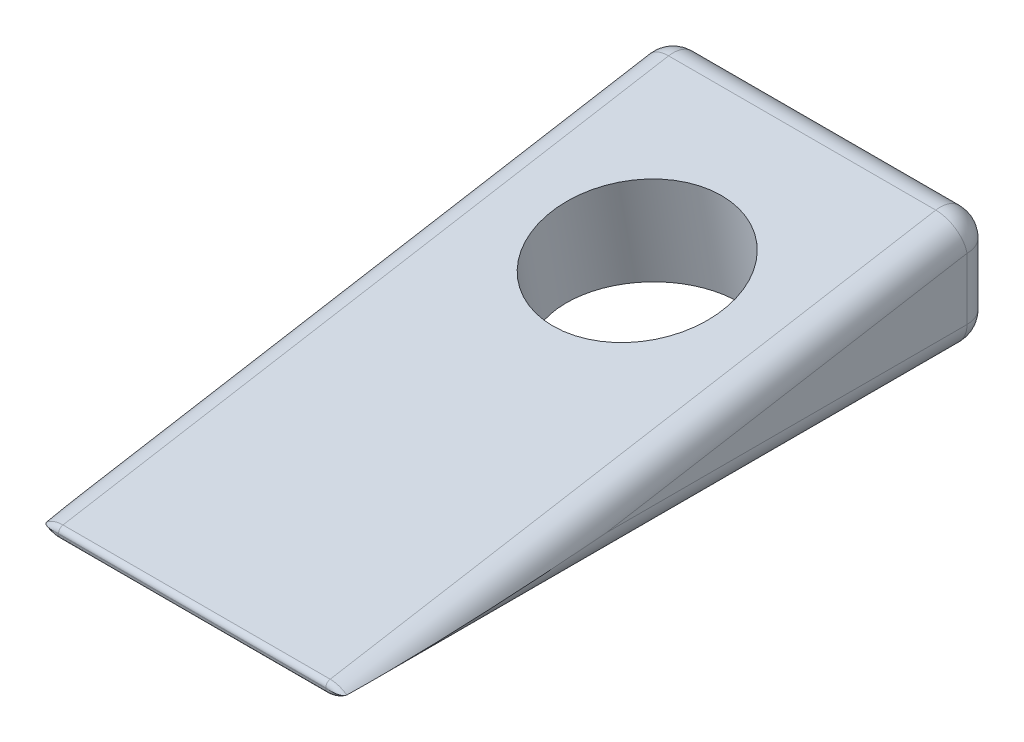
from build123d import *

# Parameters (mm, degrees)
SKETCH1_W               = 9.525
SKETCH1_H               = 19.05
BOSS_EXTRUDE1_DEPTH     = 6.35
CUT_EXTRUDE4_DEPTH      = 15.892070037
CUT_EXTRUDE4_DEPTH_BACK = 15.892070037
CUT_EXTRUDE6_DEPTH      = 11.962309672
CUT_EXTRUDE6_DEPTH_BACK = 11.962309672
SKETCH7_R               = 2.54
FILLET2_R               = 0.79375
FILLET3_R               = 0.15875


with BuildPart() as part:
    # Sketch1 → Boss-Extrude1 (new body)
    with BuildSketch(Plane(origin=(0, 0, 0), x_dir=(1, 0, 0), z_dir=(0, 1, 0))):
        Rectangle(SKETCH1_W, SKETCH1_H)
    extrude(amount=BOSS_EXTRUDE1_DEPTH)

    # Sketch4 → Cut-Extrude4 (cut, two sides: drawn at the far end of the back side and taken through both)
    with BuildSketch(Plane.ZY.offset(4.7625).offset(-CUT_EXTRUDE4_DEPTH_BACK)):
        Polygon((9.525, 0.311917294), (-9.525, 3.56560647), (-9.525, 6.35), (9.525, 6.35), align=None)
    extrude(amount=CUT_EXTRUDE4_DEPTH + CUT_EXTRUDE4_DEPTH_BACK, mode=Mode.SUBTRACT)

    # Sketch7 → Cut-Extrude6 (cut, two sides: drawn at the far end of the back side and taken through both)
    with BuildSketch(Plane(origin=(0, 1.911087398, 0.162031127), x_dir=(1, 0, 0), z_dir=(0, -0.9857256920245803, -0.16835931837193446)).offset(-CUT_EXTRUDE6_DEPTH_BACK)):
        with Locations(Location((0, -3.914374553, 0), (0, 0, 270))):
            Circle(SKETCH7_R)
    extrude(amount=CUT_EXTRUDE6_DEPTH + CUT_EXTRUDE6_DEPTH_BACK, mode=Mode.SUBTRACT)

    # Fillet2
    # the kernel refuses this fillet: 0.79375 mm, written as the material it takes off along each edge
    with BuildSketch(Plane(origin=(3.96875, 0.79375, -8.73125), x_dir=(1, 0, 0), z_dir=(0, -1, 0))) as fillet2_piece_1_section:
        Polygon((0, 0), (FILLET2_R, 0), (FILLET2_R, -FILLET2_R), (0, -FILLET2_R), align=None)
    fillet2_piece_1 = extrude(amount=FILLET2_R, mode=Mode.PRIVATE)
    fillet2_piece_1 = fillet2_piece_1 - Plane(origin=(3.96875, 0.79375, -8.73125), x_dir=(-0.7071067811865475, 0, 0.7071067811865475), z_dir=(0, -1, 0)) * Sphere(FILLET2_R, mode=Mode.PRIVATE)
    add(fillet2_piece_1, mode=Mode.SUBTRACT)
    with BuildSketch(Plane(origin=(3.96875, 2.624791783, -8.73125), x_dir=(0, 0.9857256920245803, 0.16835931837193446), z_dir=(1, 0, 0))) as fillet2_piece_2_section:
        Polygon((0, 0), (FILLET2_R, 0), (FILLET2_R, -FILLET2_R * 1.18527834653), (-FILLET2_R * 0.168359318372, -FILLET2_R * 0.985725692025), align=None)
    fillet2_piece_2 = extrude(amount=FILLET2_R, mode=Mode.PRIVATE)
    fillet2_piece_2 = fillet2_piece_2 - Plane(origin=(3.96875, 2.624791783, -8.73125), x_dir=(0, -0.7643164653374722, 0.6448413299518206), z_dir=(1, 0, 0)) * Sphere(FILLET2_R, mode=Mode.PRIVATE)
    add(fillet2_piece_2, mode=Mode.SUBTRACT)
    with BuildSketch(Plane(origin=(-3.96875, 0.79375, -8.73125), x_dir=(-1, 0, 0), z_dir=(0, -1, 0))) as fillet2_piece_3_section:
        Polygon((0, 0), (FILLET2_R, 0), (FILLET2_R, FILLET2_R), (0, FILLET2_R), align=None)
    fillet2_piece_3 = extrude(amount=FILLET2_R, mode=Mode.PRIVATE)
    fillet2_piece_3 = fillet2_piece_3 - Plane(origin=(-3.96875, 0.79375, -8.73125), x_dir=(0.7071067811865475, 0, 0.7071067811865475), z_dir=(0, -1, 0)) * Sphere(FILLET2_R, mode=Mode.PRIVATE)
    add(fillet2_piece_3, mode=Mode.SUBTRACT)
    with BuildSketch(Plane(origin=(-3.96875, 2.624791783, -8.73125), x_dir=(0, 0, -1), z_dir=(-1, 0, 0))) as fillet2_piece_4_section:
        Polygon((0, 0), (FILLET2_R, 0), (FILLET2_R, -FILLET2_R * 1.18527834653), (-FILLET2_R * 0.168359318372, -FILLET2_R * 0.985725692025), align=None)
    fillet2_piece_4 = extrude(amount=FILLET2_R, mode=Mode.PRIVATE)
    fillet2_piece_4 = fillet2_piece_4 - Plane(origin=(-3.96875, 2.624791783, -8.73125), x_dir=(0, -0.7643164653374722, 0.6448413299518206), z_dir=(-1, 0, 0)) * Sphere(FILLET2_R, mode=Mode.PRIVATE)
    add(fillet2_piece_4, mode=Mode.SUBTRACT)
    with BuildSketch(Plane(origin=(4.7625, 0, 11.509375), x_dir=(-1, 0, 0), z_dir=(0, 0, -1)), Plane(origin=(-4.7625, 0, -8.73125), x_dir=(1, 0, 0), z_dir=(0, 0, 1))) as fillet2_piece_5:
        with BuildLine():
            CenterArc((FILLET2_R, FILLET2_R), FILLET2_R, 180, 90)
            Line((0, FILLET2_R), (0, 0))
            Line((0, 0), (FILLET2_R, 0))
        make_face()
    extrude(amount=20.240625, mode=Mode.SUBTRACT)
    with BuildSketch(Plane(origin=(4.7625, 3.407211551, -8.597614791), x_dir=(0, -0.9857256920245803, -0.16835931837193446), z_dir=(0, -0.16835931837193446, 0.9857256920245803))) as fillet2_piece_6:
        with BuildLine():
            CenterArc((FILLET2_R, -FILLET2_R), FILLET2_R, 90, 90)
            Line((0, -FILLET2_R), (0, 0))
            Line((0, 0), (FILLET2_R, 0))
        make_face()
    extrude(amount=20.369423637, mode=Mode.SUBTRACT)
    with BuildSketch(Plane(origin=(3.96875, 0, -9.525), x_dir=(0, 0, 1), z_dir=(-1, 0, 0))) as fillet2_piece_7:
        with BuildLine():
            CenterArc((FILLET2_R, FILLET2_R), FILLET2_R, 180, 90)
            Line((0, FILLET2_R), (0, 0))
            Line((0, 0), (FILLET2_R, 0))
        make_face()
    extrude(amount=7.9375, mode=Mode.SUBTRACT)
    with BuildSketch(Plane(origin=(4.7625, 0.79375, -9.525), x_dir=(0, 0, 1), z_dir=(0, 1, 0))) as fillet2_piece_8:
        with BuildLine():
            CenterArc((FILLET2_R, -FILLET2_R), FILLET2_R, 90, 90)
            Line((0, -FILLET2_R), (0, 0))
            Line((0, 0), (FILLET2_R, 0))
        make_face()
    extrude(amount=1.831041783, mode=Mode.SUBTRACT)
    with BuildSketch(Plane(origin=(-3.96875, 3.56560647, -9.525), x_dir=(0, -0.16835931837193435, 0.9857256920245803), z_dir=(1, 0, 0))) as fillet2_piece_9:
        with BuildLine():
            CenterArc((FILLET2_R * 1.18527834653, FILLET2_R), FILLET2_R, 170.307559955, 99.692440045)
            Line((FILLET2_R * 0.199552654502, FILLET2_R * 1.16835931837), (0, 0))
            Line((0, 0), (FILLET2_R * 1.18527834653, 0))
        make_face()
    extrude(amount=7.9375, mode=Mode.SUBTRACT)
    with BuildSketch(Plane(origin=(-4.7625, 0.79375, -9.525), x_dir=(0, 0, 1), z_dir=(0, 1, 0))) as fillet2_piece_10:
        with BuildLine():
            CenterArc((FILLET2_R, FILLET2_R), FILLET2_R, 180, 90)
            Line((0, FILLET2_R), (0, 0))
            Line((0, 0), (FILLET2_R, 0))
        make_face()
    extrude(amount=1.831041783, mode=Mode.SUBTRACT)
    with BuildSketch(Plane(origin=(-4.7625, -0.022170729, 11.48104942), x_dir=(1, 0, 0), z_dir=(0, 0.16835931837193446, -0.9857256920245803))) as fillet2_piece_11:
        with BuildLine():
            CenterArc((FILLET2_R, FILLET2_R), FILLET2_R, 180, 90)
            Line((0, FILLET2_R), (0, 0))
            Line((0, 0), (FILLET2_R, 0))
        make_face()
    extrude(amount=20.369423637, mode=Mode.SUBTRACT)

    # Fillet3
    fillet3_edges = [part.edges().sort_by_distance(p)[0] for p in [
        (-4.216643426, 0.039702314, 9.525),
        (4.216643426, 0.039702314, 9.525),
        (4.216960585, 0.271534198, 9.525),
        (-4.216960585, 0.271534198, 9.525),
        (0, 0, 9.525),
        (0, 0.311917294, 9.525),
    ]]
    fillet(fillet3_edges, radius=FILLET3_R)


solid = part.part
